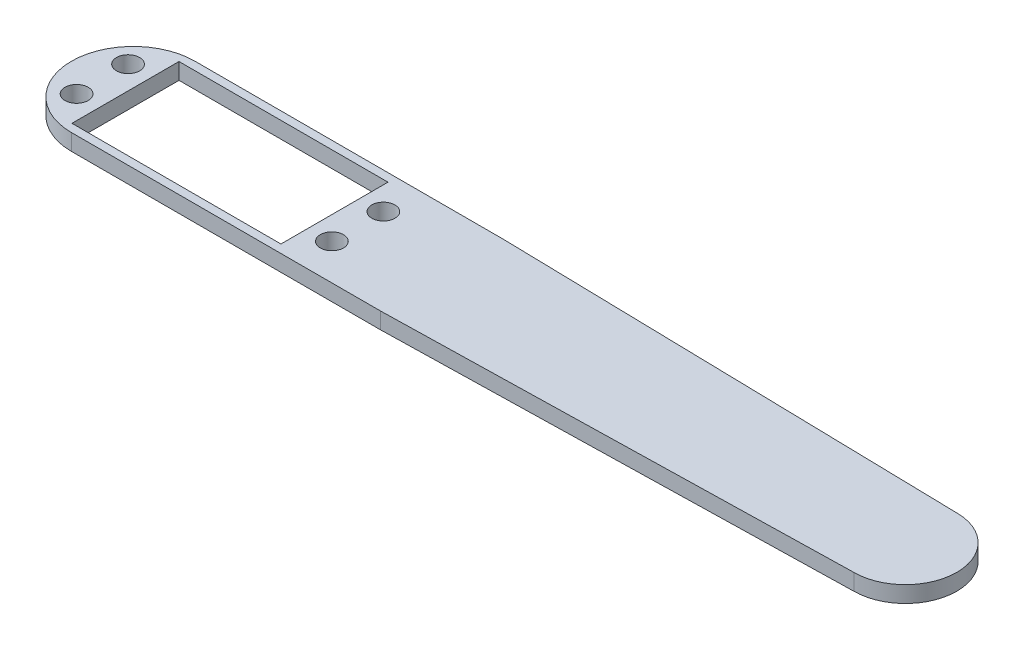
from build123d import *

# Parameters (mm, degrees)
SKETCH1_R           = 2.25
SKETCH1_W           = 40.6
SKETCH1_H           = 20.8
BOSS_EXTRUDE1_DEPTH = 3.175


with BuildPart() as part:
    # Sketch1 → Boss-Extrude1 (new body)
    with BuildSketch(Plane(origin=(0, 0, 0), x_dir=(1, 0, 0), z_dir=(0, 1, 0))):
        with BuildLine():
            Line((-141.23974096, 14.244652891), (-81.23974096, 14.244652891))
            Line((-81.23974096, 14.244652891), (8.76025904, 12.244652891))
            ThreePointArc((8.76025904, 12.244652891), (18.76025904, 2.244652891), (8.76025904, -7.755347109))
            Line((8.76025904, -7.755347109), (-81.23974096, -9.755347109))
            Line((-81.23974096, -9.755347109), (-141.23974096, -9.755347109))
            ThreePointArc((-141.23974096, -9.755347109), (-153.23974096, 2.244652891), (-141.23974096, 14.244652891))
        make_face()
        with Locations((-147.23974096, 7.244652891)):
            Circle(SKETCH1_R, mode=Mode.SUBTRACT)
        with Locations((-147.23974096, -2.755347109)):
            Circle(SKETCH1_R, mode=Mode.SUBTRACT)
        with Locations((-97.63974096, 7.244652891)):
            Circle(SKETCH1_R, mode=Mode.SUBTRACT)
        with Locations((-97.63974096, -2.755347109)):
            Circle(SKETCH1_R, mode=Mode.SUBTRACT)
        with Locations((-122.43974096, 2.244652891)):
            Rectangle(SKETCH1_W, SKETCH1_H, mode=Mode.SUBTRACT)
    extrude(amount=BOSS_EXTRUDE1_DEPTH)


solid = part.part
